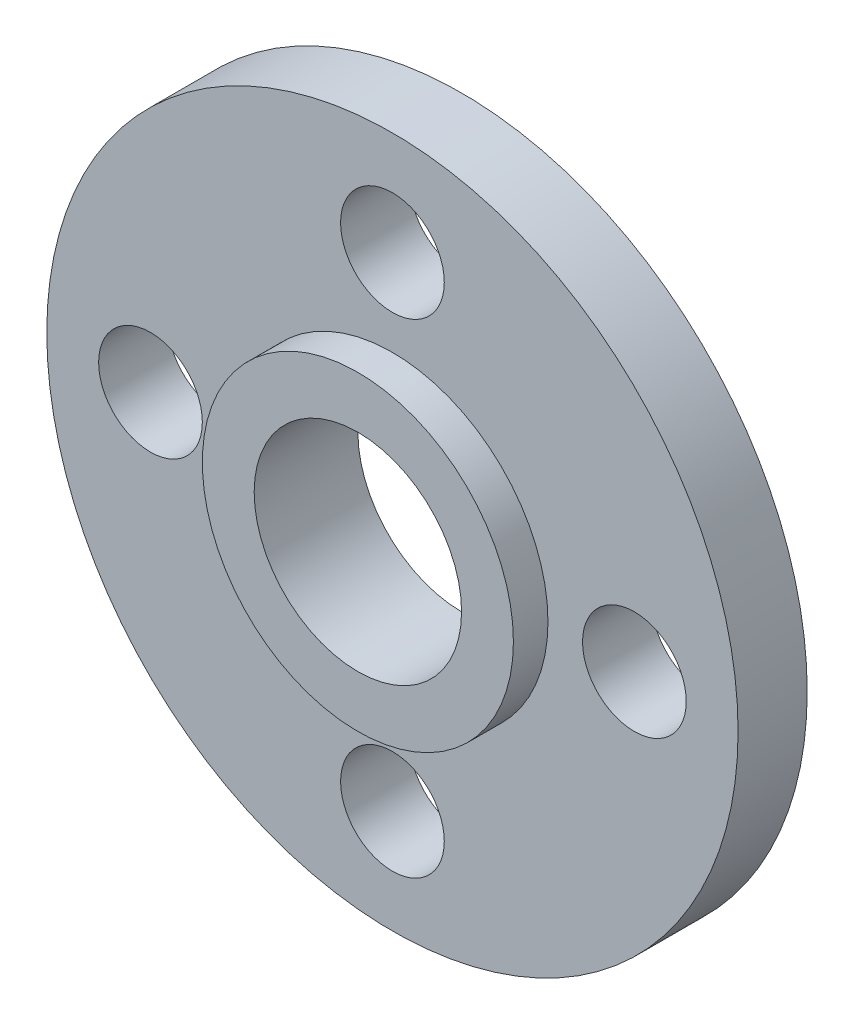
from build123d import *

# Parameters (mm, degrees)
SKETCH1_R       = 10
EXTRUDE1_DEPTH  = 2.5
SKETCH2_R       = 4.5
SKETCH2_R_2     = 3
EXTRUDE2_DEPTH  = 2
SKETCH3_R       = 1.5
EXTRUDE3_DEPTH  = 13
SKETCH4_R       = 1.5
EXTRUDE4_DEPTH  = 13
EXTRUDE5_START  = -13
SKETCH5_R       = 3
EXTRUDE5_DEPTH  = 13
EXTRUDE6_START  = -1
SKETCH6_R       = 4.5
EXTRUDE6_DEPTH  = 1
EXTRUDE7_START  = -0.5
SKETCH7_R       = 10
SKETCH7_R_2     = 4.5
EXTRUDE7_DEPTH  = 0.5
EXTRUDE8_START  = -0.5
SKETCH8_R       = 4.5
EXTRUDE8_DEPTH  = 0.5
SKETCH9_R       = 10
SKETCH9_R_2     = 3
EXTRUDE9_DEPTH  = 2
SKETCH10_R      = 1.5
EXTRUDE10_DEPTH = 12.3


with BuildPart() as part:
    # Sketch1 → Extrude1 (new body)
    with BuildSketch(Plane.XY):
        Circle(SKETCH1_R)
    extrude(amount=EXTRUDE1_DEPTH)

    # Sketch2 → Extrude2 (add)
    with BuildSketch(Plane.XY.offset(2.5)):
        Circle(SKETCH2_R)
        Circle(SKETCH2_R_2, mode=Mode.SUBTRACT)
    extrude(amount=EXTRUDE2_DEPTH)

    # Sketch3 → Extrude3 (cut)
    with BuildSketch(Plane.XY.offset(2.5)):
        Circle(SKETCH3_R)
    extrude(amount=-EXTRUDE3_DEPTH, mode=Mode.SUBTRACT)

    # Sketch4 → Extrude4 (cut)
    with BuildSketch(Plane.XY.offset(2.5)):
        with Locations((0, 7.25)):
            Circle(SKETCH4_R)
        with Locations((7.25, 0)):
            Circle(SKETCH4_R)
        with Locations((0, -7.25)):
            Circle(SKETCH4_R)
        with Locations((-7.25, 0)):
            Circle(SKETCH4_R)
    extrude(amount=-EXTRUDE4_DEPTH, mode=Mode.SUBTRACT)

    # Sketch5 → Extrude5 (cut)
    with BuildSketch(Plane.XY.offset(2.5).offset(EXTRUDE5_START)):
        Circle(SKETCH5_R)
    extrude(amount=EXTRUDE5_DEPTH, mode=Mode.SUBTRACT)

    # Sketch6 → Extrude6 (cut)
    with BuildSketch(Plane.XY.offset(4.5).offset(EXTRUDE6_START)):
        Circle(SKETCH6_R)
    extrude(amount=EXTRUDE6_DEPTH, mode=Mode.SUBTRACT)

    # Sketch7 → Extrude7 (cut)
    with BuildSketch(Plane.XY.offset(2.5).offset(EXTRUDE7_START)):
        Circle(SKETCH7_R)
        Circle(SKETCH7_R_2, mode=Mode.SUBTRACT)
    extrude(amount=EXTRUDE7_DEPTH, mode=Mode.SUBTRACT)

    # Sketch8 → Extrude8 (cut)
    with BuildSketch(Plane.XY.offset(3.5).offset(EXTRUDE8_START)):
        Circle(SKETCH8_R)
    extrude(amount=EXTRUDE8_DEPTH, mode=Mode.SUBTRACT)

    # Sketch9 → Extrude9 (add)
    with BuildSketch(Plane(origin=(0, 0, 0), x_dir=(-1, 0, 0), z_dir=(0, 0, -1))):
        Circle(SKETCH9_R)
        Circle(SKETCH9_R_2, mode=Mode.SUBTRACT)
    extrude(amount=-EXTRUDE9_DEPTH)

    # Sketch10 → Extrude10 (cut)
    with BuildSketch(Plane(origin=(0, 0, 0), x_dir=(-1, 0, 0), z_dir=(0, 0, -1))):
        with Locations((0, 7)):
            Circle(SKETCH10_R)
        with Locations((7, 0)):
            Circle(SKETCH10_R)
        with Locations((0, -7)):
            Circle(SKETCH10_R)
        with Locations((-7, 0)):
            Circle(SKETCH10_R)
    extrude(amount=-EXTRUDE10_DEPTH, mode=Mode.SUBTRACT)


solid = part.part
